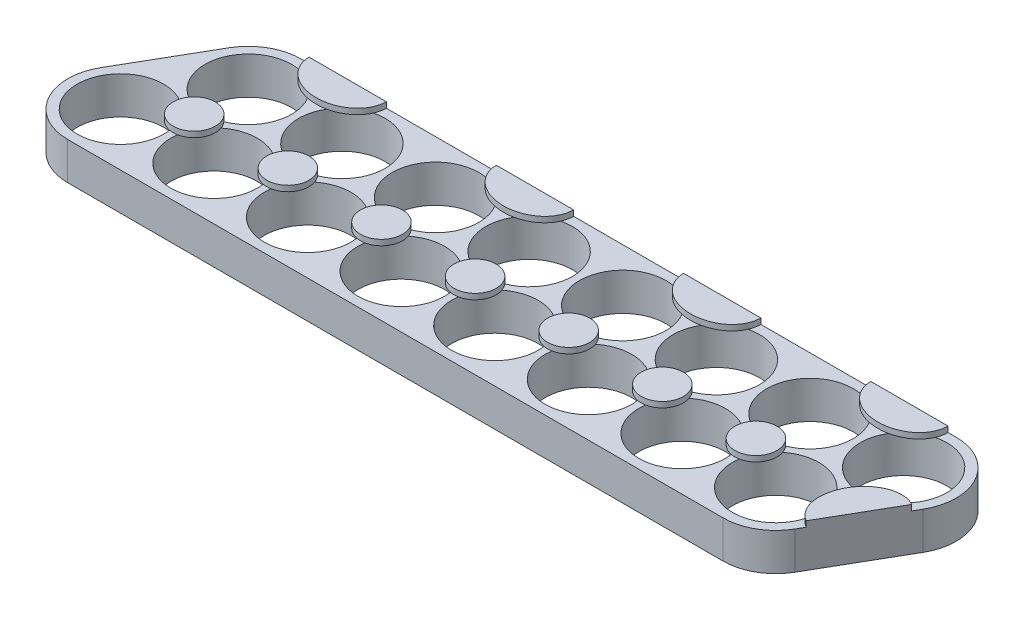
from build123d import *

# Parameters (mm, degrees)
SKETCH2_R           = 9.25
BOSS_EXTRUDE1_DEPTH = 4
SKETCH3_R           = 4.5
BOSS_EXTRUDE2_DEPTH = 1.2


with BuildPart() as part:
    # Sketch2 → Boss-Extrude1 (new, symmetric)
    with BuildSketch(Plane(origin=(0, 0, 0), x_dir=(1, 0, 0), z_dir=(0, 1, 0))):
        with BuildLine():
            Line((0.257214207, 22.945508076), (-9.742785793, 5.625))
            ThreePointArc((-9.742785793, 5.625), (-9.742785793, -5.625), (0, -11.25))
            Line((0, -11.25), (140, -11.25))
            ThreePointArc((140, -11.25), (145.625, -9.742785793), (149.742785793, -5.625))
            Line((149.742785793, -5.625), (159.742785793, 11.695508076))
            ThreePointArc((159.742785793, 11.695508076), (159.742785793, 22.945508076), (150, 28.570508076))
            Line((150, 28.570508076), (10, 28.570508076))
            ThreePointArc((10, 28.570508076), (4.375, 27.063293868), (0.257214207, 22.945508076))
        make_face()
        with Locations((10, 17.320508076)):
            Circle(SKETCH2_R, mode=Mode.SUBTRACT)
        Circle(SKETCH2_R, mode=Mode.SUBTRACT)
        with Locations((20, 0)):
            Circle(SKETCH2_R, mode=Mode.SUBTRACT)
        with Locations((40, 0)):
            Circle(SKETCH2_R, mode=Mode.SUBTRACT)
        with Locations((60, 0)):
            Circle(SKETCH2_R, mode=Mode.SUBTRACT)
        with Locations((80, 0)):
            Circle(SKETCH2_R, mode=Mode.SUBTRACT)
        with Locations((100, 0)):
            Circle(SKETCH2_R, mode=Mode.SUBTRACT)
        with Locations((120, 0)):
            Circle(SKETCH2_R, mode=Mode.SUBTRACT)
        with Locations((140, 0)):
            Circle(SKETCH2_R, mode=Mode.SUBTRACT)
        with Locations((30, 17.320508076)):
            Circle(SKETCH2_R, mode=Mode.SUBTRACT)
        with Locations((50, 17.320508076)):
            Circle(SKETCH2_R, mode=Mode.SUBTRACT)
        with Locations((70, 17.320508076)):
            Circle(SKETCH2_R, mode=Mode.SUBTRACT)
        with Locations((90, 17.320508076)):
            Circle(SKETCH2_R, mode=Mode.SUBTRACT)
        with Locations((110, 17.320508076)):
            Circle(SKETCH2_R, mode=Mode.SUBTRACT)
        with Locations((130, 17.320508076)):
            Circle(SKETCH2_R, mode=Mode.SUBTRACT)
        with Locations((150, 17.320508076)):
            Circle(SKETCH2_R, mode=Mode.SUBTRACT)
    extrude(amount=BOSS_EXTRUDE1_DEPTH, both=True)

    # Sketch3 → Boss-Extrude2 (add)
    with BuildSketch(Plane(origin=(0, 4, 0), x_dir=(1, 0, 0), z_dir=(0, 1, 0))):
        with Locations((10, 5.773502692)):
            Circle(SKETCH3_R)
        with Locations((30, 5.773502692)):
            Circle(SKETCH3_R)
        with Locations((50, 5.773502692)):
            Circle(SKETCH3_R)
        with Locations((70, 5.773502692)):
            Circle(SKETCH3_R)
        with Locations((90, 5.773502692)):
            Circle(SKETCH3_R)
        with Locations((110, 5.773502692)):
            Circle(SKETCH3_R)
        with Locations((130, 5.773502692)):
            Circle(SKETCH3_R)
        with BuildLine():
            Line((28.25, 28.570508076), (11.75, 28.570508076))
            add(Edge.make_bspline(
                [(11.75, 28.570508076), (11.75, 21.820508076), (20, 21.820508076), (28.25, 21.820508076), (28.25, 28.570508076)],
                knots=[3.141592654, 3.141592654, 3.141592654, 4.71238898, 4.71238898, 6.283185307, 6.283185307, 6.283185307], degree=2, weights=[1, 0.707106781, 1, 0.707106781, 1]))
        make_face()
        with BuildLine():
            Line((68.25, 28.570508076), (51.75, 28.570508076))
            add(Edge.make_bspline(
                [(51.75, 28.570508076), (51.75, 21.820508076), (60, 21.820508076), (68.25, 21.820508076), (68.25, 28.570508076)],
                knots=[3.141592654, 3.141592654, 3.141592654, 4.71238898, 4.71238898, 6.283185307, 6.283185307, 6.283185307], degree=2, weights=[1, 0.707106781, 1, 0.707106781, 1]))
        make_face()
        with BuildLine():
            Line((108.25, 28.570508076), (91.75, 28.570508076))
            add(Edge.make_bspline(
                [(91.75, 28.570508076), (91.75, 21.820508076), (100, 21.820508076), (108.25, 21.820508076), (108.25, 28.570508076)],
                knots=[3.141592654, 3.141592654, 3.141592654, 4.71238898, 4.71238898, 6.283185307, 6.283185307, 6.283185307], degree=2, weights=[1, 0.707106781, 1, 0.707106781, 1]))
        make_face()
        with BuildLine():
            Line((148.25, 28.570508076), (131.75, 28.570508076))
            add(Edge.make_bspline(
                [(131.75, 28.570508076), (131.75, 21.820508076), (140, 21.820508076), (148.25, 21.820508076), (148.25, 28.570508076)],
                knots=[3.141592654, 3.141592654, 3.141592654, 4.71238898, 4.71238898, 6.283185307, 6.283185307, 6.283185307], degree=2, weights=[1, 0.707106781, 1, 0.707106781, 1]))
        make_face()
        with BuildLine():
            Line((158.867785793, 10.179963619), (150.617785793, -4.109455543))
            add(Edge.make_bspline(
                [(158.867785793, 10.179963619), (153.022114317, 13.554963619), (148.897114317, 6.410254038), (144.772114317, -0.734455543), (150.617785793, -4.109455543)],
                knots=[0, 0, 0, 1.570796327, 1.570796327, 3.141592654, 3.141592654, 3.141592654], degree=2, weights=[1, 0.707106781, 1, 0.707106781, 1]))
        make_face()
    extrude(amount=BOSS_EXTRUDE2_DEPTH)


solid = part.part
